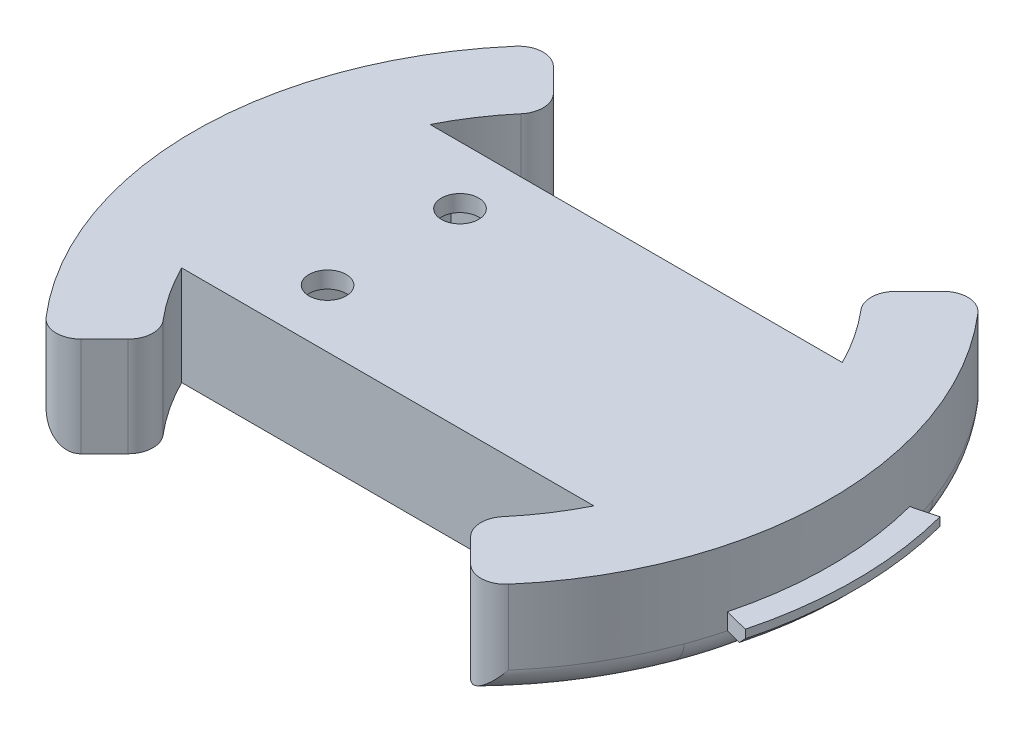
from build123d import *

# Parameters (mm, degrees)
BOSS_EXTRUDE1_DEPTH = 6
CUT_EXTRUDE3_REACH  = 46.328
SKETCH4_R           = 2.249999999999999
CUT_EXTRUDE5_DEPTH  = 10
FILLET2_R           = 3
CUT_EXTRUDE4_DEPTH  = 46.34730878629092
BOSS_EXTRUDE2_START = -6
BOSS_EXTRUDE2_DEPTH = 12
FILLET1_R           = 3


with BuildPart() as part:
    # Sketch1 → Boss-Extrude1 (new, symmetric)
    with BuildSketch(Plane(origin=(0, 0, 0), x_dir=(1, 0, 0), z_dir=(0, 1, 0))):
        with BuildLine():
            Line((-37.27870154872519, 15), (34.27870154872519, 15.000000000000009))
            ThreePointArc((34.27870154872519, 15.000000000000009), (36.950000000000024, -1.22e-15), (34.27870154872519, -15.000000000000009))
            Line((34.27870154872519, -15.000000000000009), (-37.27870154872519, -15))
            ThreePointArc((-37.27870154872519, -15), (-39.95000000000003, -5.32e-15), (-37.27870154872519, 15))
        make_face()
    extrude(amount=BOSS_EXTRUDE1_DEPTH, both=True)

    # Sketch4 → Cut-Extrude3 (cut, up to next)
    with BuildSketch(Plane.XZ.offset(6), mode=Mode.PRIVATE) as cut_extrude3_sk1:
        with Locations(Location((-15.7787015487252, 7.999999999999995, 0), (0, 0, 270))):
            Circle(SKETCH4_R)
    cut_extrude3_tool1 = extrude(cut_extrude3_sk1.sketch, amount=-CUT_EXTRUDE3_REACH, mode=Mode.PRIVATE) & part.part
    # Sketch4 → Cut-Extrude3 (cut, up to next)
    with BuildSketch(Plane.XZ.offset(6), mode=Mode.PRIVATE) as cut_extrude3_sk2:
        with Locations(Location((-15.778701548725197, -8.000000000000009, 0), (0, 0, 270))):
            Circle(SKETCH4_R)
    cut_extrude3_tool2 = extrude(cut_extrude3_sk2.sketch, amount=-CUT_EXTRUDE3_REACH, mode=Mode.PRIVATE) & part.part
    add(cut_extrude3_tool1.solids().sort_by_distance((-15.778702, -6, 8))[0], mode=Mode.SUBTRACT)
    add(cut_extrude3_tool2.solids().sort_by_distance((-15.778702, -6, -8))[0], mode=Mode.SUBTRACT)

    # Sketch12 → Cut-Extrude5 (cut)
    with BuildSketch(Plane.XZ.offset(6)):
        Polygon((-22.278701548725184, 13.399999999999999), (19.278701548725188, 13.399999999999999), (19.278701548725188, -13.400000000000007), (-22.27870154872518, -13.400000000000007), align=None)
    extrude(amount=-CUT_EXTRUDE5_DEPTH, mode=Mode.SUBTRACT)

    # Fillet2
    fillet2_edges = [part.edges().sort_by_distance(p)[0] for p in [
        (-39.95000000000003, -6, 8.9e-16),
        (36.95000000000002, -6, 4.4e-16),
    ]]
    fillet(fillet2_edges, radius=FILLET2_R)

    # Sweep1: sweep along a path in Sketch6
    with BuildLine(Plane(origin=(0, 0, 0), x_dir=(1, 0, 0), z_dir=(0, 1, 0))) as sweep1_path:
        ThreePointArc((-37.278701548725195, 14.999999999999964), (-39.95000000000002, -1.397e-14), (-37.27870154872519, -15))
    # Sketch5 → Sweep1 (sweep)
    with BuildSketch(Plane.XY):
        Polygon((-39.95000000000002, -0.9999999999999925), (-39.95000000000002, 1.0000000000000122), (-40.950000000000024, 1.000000000000012), (-40.95000000000002, 1.193e-14), align=None)
    sweep(path=sweep1_path.line)

    # Sketch7 → Cut-Extrude4 (cut, through all)
    with BuildSketch(Plane(origin=(0, 6, 0), x_dir=(1, 0, 0), z_dir=(0, 1, 0))):
        with BuildLine():
            ThreePointArc((-38.21722172245879, 15.345224395857285), (-39.06389342380726, 12.810834344677886), (-39.756751371527066, 10.230149597239155))
            Line((-39.75675137152708, 10.230149597239159), (-38.783596110075614, 10.000000000000009))
            ThreePointArc((-38.78359611007561, 10.000000000000005), (-38.106325517759984, 12.52262659789053), (-37.27870154872519, 14.999999999999984))
            Line((-37.27870154872519, 14.999999999999982), (-38.217221722458795, 15.345224395857288))
        make_face()
        with BuildLine():
            Line((-39.6613542419605, 5.000000000000006), (-40.65486268777063, 5.113765835871163))
            ThreePointArc((-40.65486268777062, 5.11376583587116), (-40.95, -1.11e-14), (-40.65486268777061, -5.113765835871172))
            Line((-40.65486268777063, -5.113765835871174), (-39.6613542419605, -4.999999999999996))
            ThreePointArc((-39.66135424196049, -4.999999999999993), (-39.95000000000002, 7.11e-15), (-39.661354241960495, 5.000000000000009))
        make_face()
        with BuildLine():
            Line((-38.783596110075614, -9.999999999999998), (-39.75675137152708, -10.23014959723917))
            ThreePointArc((-39.75675137152705, -10.230149597239167), (-39.06389342380725, -12.810834344677888), (-38.217221722458795, -15.345224395857272))
            Line((-38.2172217224588, -15.345224395857272), (-37.27870154872519, -14.999999999999964))
            ThreePointArc((-37.27870154872519, -14.999999999999964), (-38.10632551776, -12.522626597890516), (-38.78359611007561, -9.999999999999996))
        make_face()
    extrude(amount=-CUT_EXTRUDE4_DEPTH, mode=Mode.SUBTRACT)

    # Sweep2: sweep along a path in Sketch10
    with BuildLine(Plane(origin=(0, 0, 0), x_dir=(1, 0, 0), z_dir=(0, 1, 0))) as sweep2_path:
        ThreePointArc((35.53453936942811, -10.999999999999996), (36.95000000000002, 6.01e-15), (35.53453936942811, 11.000000000000009))
    # Sketch9 → Sweep2 (sweep)
    with BuildSketch(Plane.XY):
        Polygon((39.950000000000024, -2.000000000000001), (38.95000000000003, -3.000000000000001), (36.950000000000024, -3.000000000000001), (36.950000000000024, -1.0000000000000013), (39.950000000000024, -1.000000000000001), align=None)
    sweep(path=sweep2_path.line)

    # Sketch11 → Boss-Extrude2 (add)
    with BuildSketch(Plane(origin=(0, 0, 0), x_dir=(1, 0, 0), z_dir=(0, 1, 0)).offset(BOSS_EXTRUDE2_START)):
        with BuildLine():
            Line((-27.22378964255568, 30.72378964255532), (-20.152721830690165, 23.652721830689885))
            ThreePointArc((-20.152721830690165, 23.652721830689885), (-23.622735246228356, 19.577020528236766), (-26.39820228709416, 14.999999999999972))
            Line((-26.39820228709416, 14.999999999999972), (-37.278701548725195, 14.999999999999964))
            ThreePointArc((-37.278701548725195, 14.999999999999964), (-33.105477074075026, 23.408151319131726), (-27.22378964255568, 30.72378964255532))
        make_face()
        with BuildLine():
            Line((17.152721830690172, 23.652721830689885), (24.22378964255568, 30.72378964255532))
            ThreePointArc((24.22378964255568, 30.72378964255532), (30.10547707407503, 23.40815131913176), (34.27870154872519, 15.000000000000009))
            Line((34.27870154872519, 15.000000000000009), (23.39820228709414, 15.000000000000002))
            ThreePointArc((23.39820228709414, 15.000000000000002), (20.622735246228352, 19.577020528236762), (17.152721830690172, 23.652721830689885))
        make_face()
        with BuildLine():
            Line((34.27870154872519, -15.000000000000009), (23.39820228709414, -15.000000000000002))
            ThreePointArc((23.39820228709414, -15.000000000000002), (20.62273524622831, -19.577020528236723), (17.152721830690172, -23.652721830689885))
            Line((17.152721830690172, -23.652721830689885), (24.22378964255568, -30.72378964255532))
            ThreePointArc((24.22378964255568, -30.72378964255532), (30.105477074074965, -23.40815131913171), (34.27870154872519, -15.000000000000009))
        make_face()
        with BuildLine():
            Line((-37.278701548725195, -14.999999999999964), (-26.39820228709416, -14.999999999999972))
            ThreePointArc((-26.39820228709416, -14.999999999999972), (-23.622735246228356, -19.577020528236766), (-20.152721830690165, -23.652721830689885))
            Line((-20.152721830690165, -23.652721830689885), (-27.22378964255568, -30.72378964255532))
            ThreePointArc((-27.22378964255568, -30.72378964255532), (-33.105477074075026, -23.408151319131726), (-37.278701548725195, -14.999999999999964))
        make_face()
    extrude(amount=BOSS_EXTRUDE2_DEPTH)

    # Fillet1
    # the kernel refuses this fillet: 3 mm, written as the material it takes off along each edge
    with BuildSketch(Plane(origin=(-27.223789642555676, -14.061794859846085, -30.723789642555325), x_dir=(-0.6803801743920825, 0, 0.7328593441406063), z_dir=(0, 1, 0))) as fillet1_piece_1:
        with BuildLine():
            CenterArc((3.113392813537799, 2.997933740985829), FILLET1_R, 177.87335835873736, 94.25328328252505)
            Line((0.11545907255197221, 3.109258871386477), (0, 0))
            ThreePointArc((0, 0), (1.6123589719692206, -0.02992631805525288), (3.224717943938434, -1.4e-16))
        make_face()
    extrude(amount=28.12358971969217, mode=Mode.SUBTRACT)
    with BuildSketch(Plane(origin=(-20.15272183069017, -13.190833558911974, -23.652721830689885), x_dir=(-0.7071067811865506, 0, -0.7071067811865444), z_dir=(0, 1, 0))) as fillet1_piece_2:
        with BuildLine():
            CenterArc((2.8763334235647875, 2.9999999999999987), FILLET1_R, 184.721042367865, 85.27895763213502)
            ThreePointArc((-0.11348825738704518, 2.753086419753086), (-0.02838410706026842, 1.3777122721375448), (0, 0))
            Line((0, 0), (2.8763334235647893, -3e-17))
        make_face()
    extrude(amount=26.38166711782395, mode=Mode.SUBTRACT)
    with BuildSketch(Plane(origin=(3.5000000000005986, -6, 3.9257e-13), x_dir=(-0.983868674569183, 0, -0.1788922334856356), z_dir=(-0.1788922334856356, 0, 0.983868674569183))) as fillet1_piece_3:
        with BuildLine():
            CenterArc((43.45000000000071 - FILLET1_R, -FILLET1_R), FILLET1_R, 8.48e-15, 90)
            Line((43.45000000000071, -FILLET1_R), (43.45000000000071, 0))
            Line((43.45000000000071, 0), (43.45000000000071 - FILLET1_R, 0))
        make_face()
    revolve(axis=Axis((3.5000000000005986, -6, 3.9257e-13), (0, -1, 0)), revolution_arc=44.58500993548746, mode=Mode.SUBTRACT)
    with BuildSketch(Plane(origin=(17.15272183069017, -13.190833558911962, -23.652721830689885), x_dir=(0.6773830058582131, 0, 0.7356305209644934), z_dir=(0, 1, 0))) as fillet1_piece_4:
        with BuildLine():
            CenterArc((2.878986183031824, 2.9974543401739657), FILLET1_R, 182.3605211839325, 85.27895763213502)
            Line((-0.11846815714214187, 2.873892701417236), (0, 0))
            ThreePointArc((0, 0), (1.3777122721375474, 0.02838410706027035), (2.7554245442750958, 2e-17))
        make_face()
    extrude(amount=26.381667117823923, mode=Mode.SUBTRACT)
    with BuildSketch(Plane(origin=(24.22378964255568, -14.06179485984604, -30.72378964255532), x_dir=(-0.707106781186551, 0, 0.7071067811865441), z_dir=(0, 1, 0))) as fillet1_piece_5:
        with BuildLine():
            CenterArc((3.1114018587655967, 2.9999999999999996), FILLET1_R, 175.7467167174752, 94.25328328252476)
            ThreePointArc((0.11966404853807312, 3.222496909765141), (0.02992631805525848, 1.6123589719692129), (0, 0))
            Line((0, 0), (3.1114018587655963, 1.6e-16))
        make_face()
    extrude(amount=28.123589719692085, mode=Mode.SUBTRACT)
    with BuildSketch(Plane(origin=(-6.4999999999996945, -6, -1.6342e-13), x_dir=(0.5751444375352646, 0, -0.8180518785335342), z_dir=(-0.8180518785335342, 0, -0.5751444375352646))) as fillet1_piece_6:
        with BuildLine():
            CenterArc((43.44999999999968 - FILLET1_R, -FILLET1_R), FILLET1_R, 8.48e-15, 90)
            Line((43.44999999999968, -FILLET1_R), (43.44999999999968, 0))
            Line((43.44999999999968, 0), (43.44999999999968 - FILLET1_R, 0))
        make_face()
    revolve(axis=Axis((-6.4999999999996945, -6, -1.6342e-13), (0, -1, 0)), revolution_arc=44.58500993548848, mode=Mode.SUBTRACT)
    with BuildSketch(Plane(origin=(24.22378964255568, -14.061794859846156, 30.723789642555325), x_dir=(-0.7071067811865503, 0, -0.7071067811865447), z_dir=(0, 1, 0))) as fillet1_piece_7:
        with BuildLine():
            CenterArc((3.1114018587656367, -2.999999999999999), FILLET1_R, 90.00000000000006, 94.25328328252562)
            ThreePointArc((0.1196640485381212, -3.222496909765186), (0.02992631805528244, -1.6123589719692302), (0, 0))
            Line((0, 0), (3.1114018587656336, 8e-17))
        make_face()
    extrude(amount=28.12358971969231, mode=Mode.SUBTRACT)
    with BuildSketch(Plane(origin=(17.152721830690176, -13.190833558911836, 23.652721830689888), x_dir=(0.6773830058582013, 0, -0.7356305209645043), z_dir=(0, 1, 0))) as fillet1_piece_8:
        with BuildLine():
            CenterArc((2.8789861830317705, -2.9974543401739693), FILLET1_R, 92.36052118393214, 85.2789576321343)
            Line((-0.11846815714219594, -2.8738927014171836), (0, 0))
            ThreePointArc((0, 0), (1.377712272137523, -0.02838410706026628), (2.75542454427506, -1.6e-16))
        make_face()
    extrude(amount=26.381667117823667, mode=Mode.SUBTRACT)
    with BuildSketch(Plane(origin=(-6.500000000002743, -6, -1.78524e-12), x_dir=(0.5751444375352907, 0, 0.8180518785335158), z_dir=(-0.8180518785335158, 0, 0.5751444375352907))) as fillet1_piece_9:
        with BuildLine():
            CenterArc((43.45000000000323 - FILLET1_R, FILLET1_R), FILLET1_R, 270, 89.99999999999999)
            Line((43.45000000000323, FILLET1_R), (43.45000000000323, 0))
            Line((43.45000000000323, 0), (43.45000000000323 - FILLET1_R, 0))
        make_face()
    revolve(axis=Axis((-6.500000000002743, -6, -1.78524e-12), (0, 1, 0)), revolution_arc=44.58500993548482, mode=Mode.SUBTRACT)
    with BuildSketch(Plane(origin=(-27.223789642555676, -14.06179485984606, 30.723789642555317), x_dir=(0.7071067811865516, 0, -0.7071067811865436), z_dir=(0, 1, 0))) as fillet1_piece_10:
        with BuildLine():
            CenterArc((3.1114018587656043, 3.0000000000000018), FILLET1_R, 175.7467167174751, 94.25328328252488)
            ThreePointArc((0.11966404853808318, 3.2224969097651486), (0.02992631805526974, 1.6123589719692102), (0, 0))
            Line((0, 0), (3.111401858765604, -1e-16))
        make_face()
    extrude(amount=28.12358971969212, mode=Mode.SUBTRACT)
    with BuildSketch(Plane(origin=(-20.15272183069017, -13.190833558911962, 23.652721830689885), x_dir=(-0.6773830058582145, 0, -0.7356305209644921), z_dir=(0, 1, 0))) as fillet1_piece_11:
        with BuildLine():
            CenterArc((2.8789861830318295, 2.9974543401739657), FILLET1_R, 182.36052118393246, 85.27895763213508)
            Line((-0.11846815714213627, 2.8738927014172364), (0, 0))
            ThreePointArc((0, 0), (1.3777122721375523, 0.02838410706027291), (2.7554245442751006, -2e-17))
        make_face()
    extrude(amount=26.381667117823923, mode=Mode.SUBTRACT)
    with BuildSketch(Plane(origin=(3.5000000000005986, -6, -3.9257e-13), x_dir=(-0.5751444375352724, 0, 0.8180518785335287), z_dir=(0.8180518785335287, 0, 0.5751444375352724))) as fillet1_piece_12:
        with BuildLine():
            CenterArc((43.45000000000071 - FILLET1_R, -FILLET1_R), FILLET1_R, 8.48e-15, 90)
            Line((43.45000000000071, -FILLET1_R), (43.45000000000071, 0))
            Line((43.45000000000071, 0), (43.45000000000071 - FILLET1_R, 0))
        make_face()
    revolve(axis=Axis((3.5000000000005986, -6, -3.9257e-13), (0, -1, 0)), revolution_arc=44.58500993548747, mode=Mode.SUBTRACT)


solid = part.part
